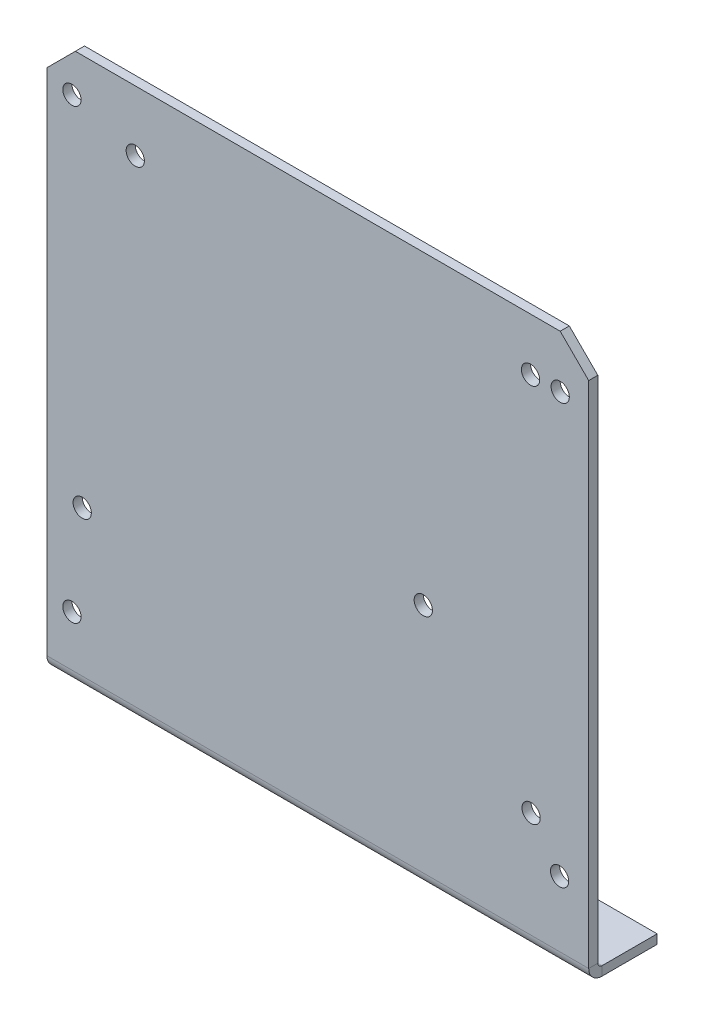
from build123d import *

# Parameters (mm, degrees)
SM_BASE_FLANGE_2_DEPTH           = 1.6
SM_EDGE_FLANGE_2_STRIP_W         = 7.8732
SM_EDGE_FLANGE_2_STRIP_H         = 1.6
SM_EDGE_FLANGE_2_STRIP_CUT_DEPTH = 95
SM_EDGE_FLANGE_2_DEPTH           = 95
SKETCH_16_R                      = 4.05
EXTRUDE_1_DEPTH                  = 1.9
SKETCH_17_R                      = 1.6
CUT_EXTRUDE_1_DEPTH              = 106.203897266
SKETCH_18_R                      = 1.6
CUT_EXTRUDE_2_DEPTH              = 70.102966651


# Sheet-metal steps are written as plain solids
with BuildPart() as part:
    # 草图1 → 基体-法兰2 (new body)
    with BuildSketch(Plane.XY):
        Polygon((-47.5, 42.5), (-42.5, 47.5), (42.5, 47.5), (47.5, 42.5), (47.5, -47.5), (-47.5, -47.5), align=None)
    extrude(amount=-SM_BASE_FLANGE_2_DEPTH)

    # 边线-法兰2 strip (across the edge) → 边线-法兰2 strip cut (cut)
    with BuildSketch(Plane(origin=(47.5, -47.5, -1.6), x_dir=(0, 1, 0), z_dir=(-1, 0, 0))):
        with Locations((-3.2, -0.8)):
            Rectangle(SM_EDGE_FLANGE_2_STRIP_W, SM_EDGE_FLANGE_2_STRIP_H)
    extrude(amount=SM_EDGE_FLANGE_2_STRIP_CUT_DEPTH, mode=Mode.SUBTRACT)

    # 边线-法兰2 section (across the edge) → 边线-法兰2 (add)
    with BuildSketch(Plane(origin=(47.5, -47.5, -1.6), x_dir=(0, 1, 0), z_dir=(-1, 0, 0))):
        with BuildLine():
            Line((-1.6, 0.7366), (-1.6, 10.4))
            Line((-1.6, 10.4), (0, 10.4))
            Line((0, 10.4), (0, 0.7366))
            ThreePointArc((0, 0.7366), (0.215745145, 0.215745145), (0.7366, 0))
            Line((0.7366, 0), (0.7366, -1.6))
            ThreePointArc((0.7366, -1.6), (-0.915625705, -0.915625705), (-1.6, 0.7366))
        make_face()
    extrude(amount=SM_EDGE_FLANGE_2_DEPTH)

    # 草图16 → 凸台-拉伸1 (add)
    with BuildSketch(Plane(origin=(0, -47.5, 0), x_dir=(1, 0, 0), z_dir=(0, 1, 0))):
        with Locations(Location((-30, 7, 0), (0, 0, 90))):
            Circle(SKETCH_16_R)
    extrude_1 = extrude(amount=EXTRUDE_1_DEPTH)

    # 草图17 → 切除-拉伸1 (cut, through all)
    with BuildSketch(Plane(origin=(0, -45.6, 0), x_dir=(1, 0, 0), z_dir=(0, 1, 0))):
        with Locations(Location((-30, 7, 0), (0, 0, 270))):
            Circle(SKETCH_17_R)
    cut_extrude_1 = extrude(amount=-CUT_EXTRUDE_1_DEPTH, mode=Mode.SUBTRACT)

    # 镜向1: 凸台-拉伸1, 切除-拉伸1 across plane
    add(extrude_1.mirror(Plane(origin=(0, 0, 0), x_dir=(0, 0, 1), z_dir=(1, 0, 0))))
    add(cut_extrude_1.mirror(Plane(origin=(0, 0, 0), x_dir=(0, 0, 1), z_dir=(1, 0, 0))), mode=Mode.SUBTRACT)

    # 草图18 → 切除-拉伸2 (cut, through all)
    with BuildSketch(Plane(origin=(0, 0, -1.6), x_dir=(-1, 0, 0), z_dir=(0, 0, -1))):
        with Locations((-42.5, 38.3)):
            Circle(SKETCH_18_R)
        with Locations((32, 36.9)):
            Circle(SKETCH_18_R)
        with Locations((43.1, 40.6)):
            Circle(SKETCH_18_R)
        with Locations((-18.5, -6.1)):
            Circle(SKETCH_18_R)
        with Locations((-37.4, -28.2)):
            Circle(SKETCH_18_R)
        with Locations((-42.4, -35.3)):
            Circle(SKETCH_18_R)
        with Locations((41.3, -21.2)):
            Circle(SKETCH_18_R)
        with Locations((43.1, -37.9)):
            Circle(SKETCH_18_R)
        with Locations((-37.3, 38.3)):
            Circle(SKETCH_18_R)
    extrude(amount=-CUT_EXTRUDE_2_DEPTH, mode=Mode.SUBTRACT)


solid = part.part
